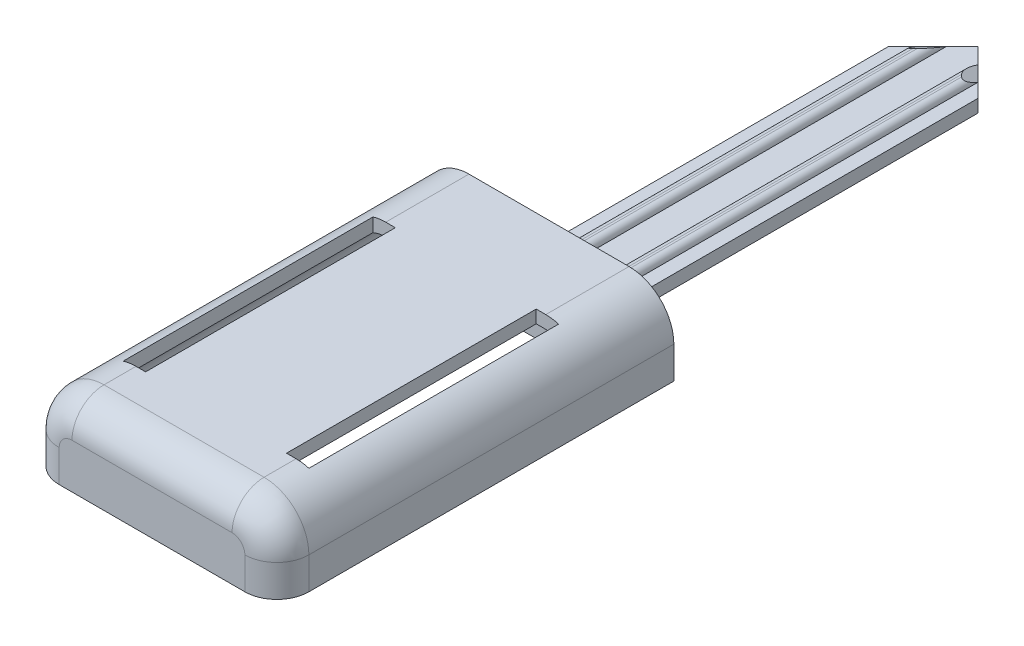
from build123d import *

# Parameters (mm, degrees)
BOSS_EXTRUDE1_DEPTH      = 60
BOSS_EXTRUDE2_DEPTH      = 2
BOSS_EXTRUDE3_START      = 60
BOSS_EXTRUDE3_DEPTH      = 2
FILLET1_R                = 5
BOSS_EXTRUDE4_DEPTH      = 2
FILLET2_R                = 2
BOSS_EXTRUDE5_DEPTH      = 2
BOSS_EXTRUDE5_DEPTH_BACK = 1
CHAMFER3_SIZE            = 1
BOSS_EXTRUDE6_DEPTH      = 1
FILLET3_R                = 1
CHAMFER4_SIZE            = 1
CHAMFER4_SIZE_2          = 1.804047755
CUT_EXTRUDE1_DEPTH       = 72.17056976
CUT_EXTRUDE1_DEPTH_BACK  = 72.17056976
SKETCH6_W                = 3.5
SKETCH6_H                = 39


# Some blends are built 0.0001 mm under size
with BuildPart() as part:
    # Sketch1 → Boss-Extrude1 (new body)
    with BuildSketch(Plane.XY):
        with BuildLine():
            Line((-12.5, 0), (12.5, 0))
            ThreePointArc((12.5, 0), (16.035533906, -1.464466094), (17.5, -5))
            Line((17.5, -5), (17.5, -10))
            Line((17.5, -10), (19.5, -10))
            Line((19.5, -10), (19.5, -5))
            ThreePointArc((19.5, -5), (17.449747468, -0.050252532), (12.5, 2))
            Line((12.5, 2), (-12.5, 2))
            ThreePointArc((-12.5, 2), (-17.449747468, -0.050252532), (-19.5, -5))
            Line((-19.5, -5), (-19.5, -10))
            Line((-19.5, -10), (-17.5, -10))
            Line((-17.5, -10), (-17.5, -5))
            ThreePointArc((-17.5, -5), (-16.035533906, -1.464466094), (-12.5, 0))
        make_face()
    extrude(amount=BOSS_EXTRUDE1_DEPTH)

    # Sketch2 → Boss-Extrude2 (add)
    with BuildSketch(Plane.XY):
        with BuildLine():
            Line((19.5, -10), (19.5, -5))
            ThreePointArc((19.5, -5), (17.449747468, -0.050252532), (12.5, 2))
            Line((12.5, 2), (-12.5, 2))
            ThreePointArc((-12.5, 2), (-17.449747468, -0.050252532), (-19.5, -5))
            Line((-19.5, -5), (-19.5, -10))
            Line((-19.5, -10), (19.5, -10))
        make_face()
    extrude(amount=BOSS_EXTRUDE2_DEPTH)

    # Sketch2<2> → Boss-Extrude3 (add)
    with BuildSketch(Plane.XY.offset(BOSS_EXTRUDE3_START)):
        with BuildLine():
            Line((19.5, -10), (19.5, -5))
            ThreePointArc((19.5, -5), (17.449747468, -0.050252532), (12.5, 2))
            Line((12.5, 2), (-12.5, 2))
            ThreePointArc((-12.5, 2), (-17.449747468, -0.050252532), (-19.5, -5))
            Line((-19.5, -5), (-19.5, -10))
            Line((-19.5, -10), (19.5, -10))
        make_face()
    extrude(amount=BOSS_EXTRUDE3_DEPTH)

    # Fillet1
    fillet1_edges = [part.edges().sort_by_distance(p)[0] for p in [
        (-17.5, -7.5, 60),
        (-16.035533906, -1.464466094, 60),
        (0, 0, 60),
        (16.035533906, -1.464466094, 60),
        (-17.449747468, -0.050252532, 62),
        (17.449747468, -0.050252532, 62),
        (-19.5, -7.5, 62),
        (19.5, -7.5, 62),
        (0, 2, 62),
        (17.5, -7.5, 60),
    ]]
    fillet(fillet1_edges, radius=FILLET1_R)

    # Sketch3 → Boss-Extrude4 (add)
    with BuildSketch(Plane.XZ.offset(10)):
        Polygon((-7, 0), (-7, -60), (0, -67), (7, -60), (7, 0), align=None)
    extrude(amount=-BOSS_EXTRUDE4_DEPTH)

    # Fillet2
    fillet2_edges = [part.edges().sort_by_distance(p)[0] for p in [
        (0, -8, 0),
        (-7, -9, 0),
        (7, -9, 0),
    ]]
    fillet(fillet2_edges, radius=FILLET2_R)

    # Sketch4 → Boss-Extrude5 (add, two sides: drawn at the far end of the back side and taken through both)
    with BuildSketch(Plane.XZ.offset(10).offset(-BOSS_EXTRUDE5_DEPTH_BACK)):
        with BuildLine():
            Line((-17.5, 2), (17.5, 2))
            Line((17.5, 2), (17.5, 55))
            ThreePointArc((17.5, 55), (16.035533906, 58.535533906), (12.5, 60))
            Line((12.5, 60), (-12.5, 60))
            ThreePointArc((-12.5, 60), (-16.035533906, 58.535533906), (-17.5, 55))
            Line((-17.5, 55), (-17.5, 2))
        make_face()
        with BuildLine():
            Line((-16.5, 3), (16.5, 3))
            Line((16.5, 3), (16.5, 55))
            ThreePointArc((16.5, 55), (15.328427125, 57.828427125), (12.5, 59))
            Line((12.5, 59), (-12.5, 59))
            ThreePointArc((-12.5, 59), (-15.328427125, 57.828427125), (-16.5, 55))
            Line((-16.5, 55), (-16.5, 3))
        make_face(mode=Mode.SUBTRACT)
    extrude(amount=BOSS_EXTRUDE5_DEPTH + BOSS_EXTRUDE5_DEPTH_BACK)

    # Chamfer3
    chamfer3_edges = [part.edges().sort_by_distance(p)[0] for p in [
        (-17.5, -9, 28.5),
        (-16.035533906, -9, 58.535533906),
        (0, -9, 60),
        (16.035533906, -9, 58.535533906),
        (17.5, -9, 28.5),
        (0, -9, 2),
    ]]
    chamfer(chamfer3_edges, length=CHAMFER3_SIZE - 0.0001)  # a hair under: the kernel refuses the full size

    # Sketch5 → Boss-Extrude6 (add)
    with BuildSketch(Plane(origin=(0, -8, 0), x_dir=(1, 0, 0), z_dir=(0, 1, 0))):
        Polygon((-4.825973992, 0), (-2.477626604, 0), (-2.477626604, 64.522373396), (-4.825973992, 62.174026008), align=None)
        Polygon((4.825973992, 0), (4.825973992, 62.174026008), (2.477626604, 64.522373396), (2.477626604, 0), align=None)
    extrude(amount=BOSS_EXTRUDE6_DEPTH)

    # Fillet3
    fillet3_edges = [part.edges().sort_by_distance(p)[0] for p in [
        (4.825973992, -7, -31.2209876),
        (2.477626604, -7, -32.395161294),
        (-2.477626604, -7, -32.395161294),
        (-4.825973992, -7, -31.2209876),
    ]]
    fillet(fillet3_edges, radius=FILLET3_R - 0.0001)  # a hair under: the kernel refuses the full size

    # Chamfer4
    # the kernel refuses this chamfer: 1.804047755, 1 mm, written as the material it takes off along each edge
    with BuildSketch(Plane(origin=(-0.176240013, -7, -66.823759987), x_dir=(-0.04304000526140607, -0.9981458389905735, -0.043040005261406056), z_dir=(-0.7071067811865475, 0, 0.7071067811865477)), Plane(origin=(7.127360583, -7, -59.872639417), x_dir=(0.043040005261406056, -0.9981458389905735, -0.04304000526140604), z_dir=(-0.7071067811865475, 0, -0.7071067811865477))) as chamfer4_piece_1:
        Polygon((CHAMFER4_SIZE * 0.998145838991, CHAMFER4_SIZE * 0.0608677591653), (-CHAMFER4_SIZE_2 * 0.0608677591744, CHAMFER4_SIZE_2 * 0.998145839141), (0, 0), align=None)
    extrude(amount=9.830368984, mode=Mode.SUBTRACT)

    # Sketch6 → Cut-Extrude1 (cut, two sides: drawn at the far end of the back side and taken through both)
    with BuildSketch(Plane(origin=(0, 2, 0), x_dir=(1, 0, 0), z_dir=(0, 1, 0)).offset(-CUT_EXTRUDE1_DEPTH_BACK)):
        with Locations((12.75, -32.5)):
            Rectangle(SKETCH6_W, SKETCH6_H)
        with Locations((-12.75, -32.5)):
            Rectangle(SKETCH6_W, SKETCH6_H)
    extrude(amount=CUT_EXTRUDE1_DEPTH + CUT_EXTRUDE1_DEPTH_BACK, mode=Mode.SUBTRACT)


solid = part.part
